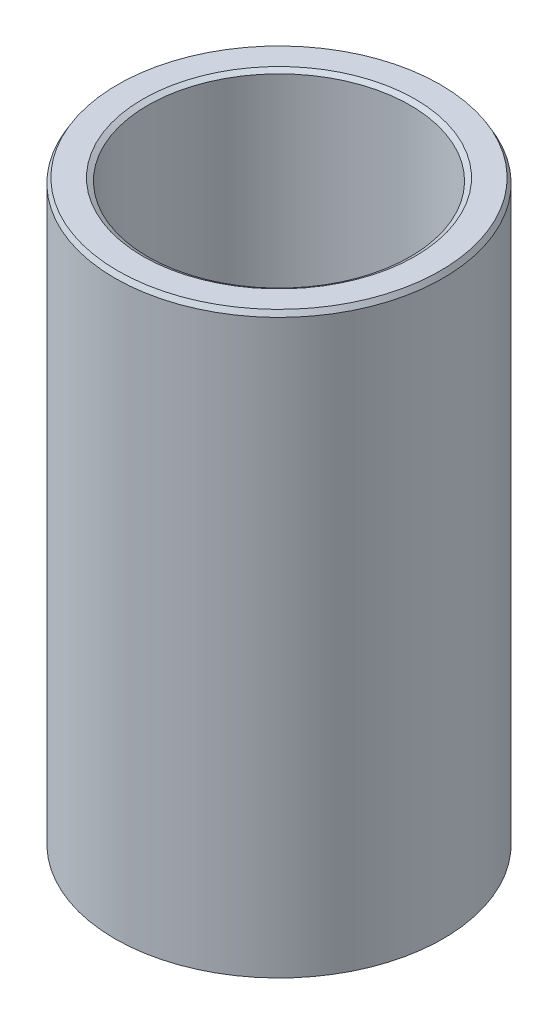
from build123d import *
from OCP.BRepFilletAPI import BRepFilletAPI_MakeChamfer

# Parameters (mm, degrees)
SKETCH1_R           = 47.5
BOSS_EXTRUDE1_DEPTH = 167.78729173
SKETCH2_R           = 37.968608709
CUT_EXTRUDE1_DEPTH  = 181.734820292
CHAMFER1_SIZE       = 1.428454961
CHAMFER1_SIZE2      = 0.824718856


with BuildPart() as part:
    # Sketch1 → Boss-Extrude1 (new body)
    with BuildSketch(Plane(origin=(0, 0, 0), x_dir=(1, 0, 0), z_dir=(0, 1, 0))):
        Circle(SKETCH1_R)
    extrude(amount=BOSS_EXTRUDE1_DEPTH)

    # Sketch2 → Cut-Extrude1 (cut, through all)
    with BuildSketch(Plane(origin=(0, 0, 0), x_dir=(1, 0, 0), z_dir=(0, 1, 0))):
        Circle(SKETCH2_R)
    extrude(amount=CUT_EXTRUDE1_DEPTH, mode=Mode.SUBTRACT)

    # Chamfer1: one chamfer whose edges measure the first distance from different faces: ONE call of the kernel's chamfer builder (chamfer() names one face for all edges)
    chamfer1_edges_1 = [part.edges().sort_by_distance(p)[0] for p in [
        (-37.968608709, 167.78729173, 0),
    ]]
    chamfer1_side_1 = [part.faces().sort_by_distance(p)[0] for p in [
        (-46.156497116, 167.78729173, 0),
    ]]
    chamfer1_edges_2 = [part.edges().sort_by_distance(p)[0] for p in [
        (-37.968608709, 0, 0),
    ]]
    chamfer1_side_2 = [part.faces().sort_by_distance(p)[0] for p in [
        (-37.968608709, 83.893645865, 0),
    ]]
    chamfer1_edges_3 = [part.edges().sort_by_distance(p)[0] for p in [
        (-47.5, 0, 0),
    ]]
    chamfer1_side_3 = [part.faces().sort_by_distance(p)[0] for p in [
        (-46.156497116, 0, 0),
    ]]
    chamfer1_edges_4 = [part.edges().sort_by_distance(p)[0] for p in [
        (-47.5, 167.78729173, 0),
    ]]
    chamfer1_side_4 = [part.faces().sort_by_distance(p)[0] for p in [
        (-47.5, 83.893645865, 0),
    ]]
    chamfer1 = BRepFilletAPI_MakeChamfer(part.part.solid().wrapped)
    for e in chamfer1_edges_1:
        chamfer1.Add(CHAMFER1_SIZE, CHAMFER1_SIZE2, e.wrapped, chamfer1_side_1[0].wrapped)  # the first distance lies on this face
    for e in chamfer1_edges_2:
        chamfer1.Add(CHAMFER1_SIZE, CHAMFER1_SIZE2, e.wrapped, chamfer1_side_2[0].wrapped)  # the first distance lies on this face
    for e in chamfer1_edges_3:
        chamfer1.Add(CHAMFER1_SIZE, CHAMFER1_SIZE2, e.wrapped, chamfer1_side_3[0].wrapped)  # the first distance lies on this face
    for e in chamfer1_edges_4:
        chamfer1.Add(CHAMFER1_SIZE, CHAMFER1_SIZE2, e.wrapped, chamfer1_side_4[0].wrapped)  # the first distance lies on this face
    add(Compound.cast(chamfer1.Shape()), mode=Mode.REPLACE)


solid = part.part
